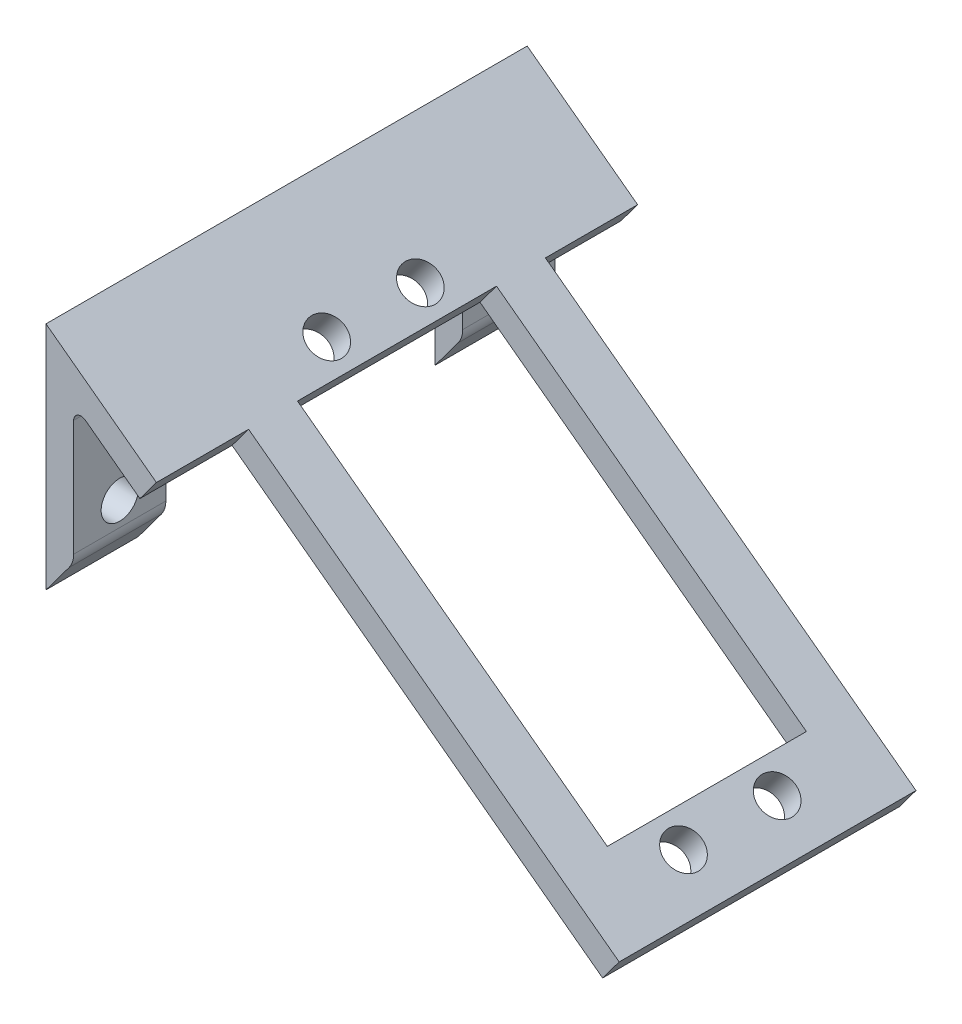
from build123d import *

# Parameters (mm, degrees)
BOSS_EXTRUDE1_DEPTH        = 10
CUT_EXTRUDE1_DEPTH         = 24.288163202
M3_5_CLEARANCE_HOLE1_D     = 4.04
M3_5_CLEARANCE_HOLE1_DEPTH = 11.976330523
M3_5_CLEARANCE_HOLE2_D     = 4.04
M3_5_CLEARANCE_HOLE2_DEPTH = 3
FILLET1_R                  = 2.5
COMBINE1_START             = -42.798318907
COMBINE1_DEPTH             = 32.198103497
COMBINE1_START_2           = -52.798318907
COMBINE1_2_DEPTH           = 10
COMBINE1_3_DEPTH           = 5.304051749
COMBINE1_START_3           = -15.904267158
COMBINE1_4_DEPTH           = 5.304051748


with BuildPart() as part:
    # Sketch1 → Boss-Extrude1 (new body)
    with BuildSketch(Plane.XY.offset(-0.60021541)):
        Polygon((-11.469163068, -7.348185616), (-11.452492295, -7.348185616), (0.507167456, 8.709585816), (-11.469163068, 17.629431184), align=None)
    extrude(amount=-BOSS_EXTRUDE1_DEPTH)

    # Sketch2 → Cut-Extrude1 (cut, through all)
    with BuildSketch(Plane(origin=(0, 0, -10.60021541), x_dir=(-1, 0, 0), z_dir=(0, 0, -1))):
        with BuildLine():
            Line((8.469163068, -3.342585136), (8.469163068, 10.061084473))
            ThreePointArc((8.469163068, 10.061084473), (8.028129493, 10.776027202), (7.191305305, 10.702685563))
            Line((7.191305305, 10.702685563), (1.284799154, 6.303581729))
            Line((1.284799154, 6.303581729), (8.469163068, -3.342585136))
        make_face()
    extrude(amount=-CUT_EXTRUDE1_DEPTH, mode=Mode.SUBTRACT)

    # M3.5 Clearance Hole1
    with Locations(Plane.ZY.offset(11.469163068)):
        with Locations((-5.60021541, 0.106053799)):
            Hole(M3_5_CLEARANCE_HOLE1_D / 2, depth=M3_5_CLEARANCE_HOLE1_DEPTH)

    # M3.5 Clearance Hole2
    with Locations(Plane.ZY.offset(11.469163068)):
        with Locations((-5.60021541, 8.106053799)):
            Hole(M3_5_CLEARANCE_HOLE2_D / 2, depth=M3_5_CLEARANCE_HOLE2_DEPTH)

    # Fillet1
    fillet1_edges = [part.edges().sort_by_distance(p)[0] for p in [
        (-8.469163068, -3.342585136, -5.60021541),
    ]]
    fillet(fillet1_edges, radius=FILLET1_R)

    # Combine1: read off the stored shape, not the designer's step
    # Combine1 outline → Combine1 (add)
    with BuildSketch(Plane.XY.offset(COMBINE1_START)):
        Polygon((-1.284799143, 6.30358172), (0.507167468, 8.709585807), (-11.469163068, 17.629431184), (-11.469163068, 13.888789159), align=None)
        Polygon((40.70546383, -21.229683728), (34.119044566, -16.324187738), (32.327077956, -18.730191825), (38.913497219, -23.635687815), align=None)
    extrude(amount=COMBINE1_DEPTH)

    # Combine1 2 outline → Combine1 2 (add)
    with BuildSketch(Plane.XY.offset(COMBINE1_START_2)):
        with BuildLine():
            Line((-1.284799143, 6.30358172), (0.507167468, 8.709585807))
            Line((0.507167468, 8.709585807), (-11.469163068, 17.629431184))
            Line((-11.469163068, 17.629431184), (-11.469163068, -7.348185616))
            Line((-11.469163068, -7.348185616), (-11.452492295, -7.348185616))
            Line((-11.452492295, -7.348185616), (-8.964159662, -4.00719787))
            ThreePointArc((-8.964159662, -4.00719787), (-8.596136676, -3.300496292), (-8.469163068, -2.513892362))
            Line((-8.469163068, -2.513892362), (-8.469163068, 10.061084473))
            ThreePointArc((-8.469163068, 10.061084473), (-8.028129494, 10.776027202), (-7.191305305, 10.702685563))
            Line((-7.191305305, 10.702685563), (-1.284799143, 6.30358172))
        make_face()
    extrude(amount=COMBINE1_2_DEPTH)

    # Combine1 3 outline → Combine1 3 (add)
    with BuildSketch(Plane.XY.offset(COMBINE1_START)):
        Polygon((34.119044566, -16.324187738), (0.507167462, 8.709585812), (-1.284799143, 6.30358172), (32.327077956, -18.730191825), align=None)
    extrude(amount=COMBINE1_3_DEPTH)

    # Combine1 4 outline → Combine1 4 (add)
    with BuildSketch(Plane.XY.offset(COMBINE1_START_3)):
        Polygon((34.119044566, -16.324187738), (0.507167462, 8.709585812), (-1.284799143, 6.30358172), (32.327077956, -18.730191825), align=None)
    extrude(amount=COMBINE1_4_DEPTH)

    # Combine1 5: loft between two sections, ruled curve by curve
    combine1_5_from = [
        Edge.make_three_point_arc((36.665398892, -18.220685734, -29.759967158), (35.045917541, -17.014513008, -31.779267158), (36.665398892, -18.220685734, -33.798567158)),
        Edge.make_three_point_arc((36.665398892, -18.220685734, -33.798567158), (38.284880243, -19.426858459, -31.779267158), (36.665398892, -18.220685734, -29.759967158)),
    ]
    combine1_5_to = [
        Edge.make_three_point_arc((34.873432281, -20.626689821, -29.759967158), (33.25395093, -19.420517096, -31.779267158), (34.873432281, -20.626689821, -33.798567158)),
        Edge.make_three_point_arc((34.873432281, -20.626689821, -33.798567158), (36.492913632, -21.832862546, -31.779267158), (34.873432281, -20.626689821, -29.759967158)),
    ]
    combine1_5 = Solid(Shell([*[Face.make_surface_from_curves(combine1_5_from[k], combine1_5_to[k]) for k in range(2)], Face(Wire(combine1_5_from)), Face(Wire(combine1_5_to))]))
    add(combine1_5, mode=Mode.SUBTRACT)

    # Combine1 6: loft between two sections, ruled curve by curve
    combine1_6_from = [
        Edge.make_three_point_arc((36.665398892, -18.220685734, -19.599967158), (35.045917541, -17.014513008, -21.619267158), (36.665398892, -18.220685734, -23.638567158)),
        Edge.make_three_point_arc((36.665398892, -18.220685734, -23.638567158), (38.284880243, -19.426858459, -21.619267158), (36.665398892, -18.220685734, -19.599967158)),
    ]
    combine1_6_to = [
        Edge.make_three_point_arc((34.873432281, -20.626689821, -19.599967158), (33.25395093, -19.420517096, -21.619267158), (34.873432281, -20.626689821, -23.638567158)),
        Edge.make_three_point_arc((34.873432281, -20.626689821, -23.638567158), (36.492913632, -21.832862546, -21.619267158), (34.873432281, -20.626689821, -19.599967158)),
    ]
    combine1_6 = Solid(Shell([*[Face.make_surface_from_curves(combine1_6_from[k], combine1_6_to[k]) for k in range(2)], Face(Wire(combine1_6_from)), Face(Wire(combine1_6_to))]))
    add(combine1_6, mode=Mode.SUBTRACT)

    # Combine1 7: loft between two sections, ruled curve by curve
    combine1_7_from = [
        Edge.make_three_point_arc((-2.039186858, 10.606083803, -29.759967158), (-3.658668209, 11.812256529, -31.779267158), (-2.039186858, 10.606083803, -33.798567158)),
        Edge.make_three_point_arc((-2.039186858, 10.606083803, -33.798567158), (-0.419705507, 9.399911078, -31.779267158), (-2.039186858, 10.606083803, -29.759967158)),
    ]
    combine1_7_to = [
        Edge.make_three_point_arc((-3.831153468, 8.200079716, -29.759967158), (-5.45063482, 9.406252441, -31.779267158), (-3.831153468, 8.200079716, -33.798567158)),
        Edge.make_three_point_arc((-3.831153468, 8.200079716, -33.798567158), (-2.211672117, 6.993906991, -31.779267158), (-3.831153468, 8.200079716, -29.759967158)),
    ]
    combine1_7 = Solid(Shell([*[Face.make_surface_from_curves(combine1_7_from[k], combine1_7_to[k]) for k in range(2)], Face(Wire(combine1_7_from)), Face(Wire(combine1_7_to))]))
    add(combine1_7, mode=Mode.SUBTRACT)

    # Combine1 8: loft between two sections, ruled curve by curve
    combine1_8_from = [
        Edge.make_three_point_arc((-2.039186858, 10.606083803, -19.599967158), (-3.658668209, 11.812256529, -21.619267158), (-2.039186858, 10.606083803, -23.638567158)),
        Edge.make_three_point_arc((-2.039186858, 10.606083803, -23.638567158), (-0.419705507, 9.399911078, -21.619267158), (-2.039186858, 10.606083803, -19.599967158)),
    ]
    combine1_8_to = [
        Edge.make_three_point_arc((-3.831153468, 8.200079716, -19.599967158), (-5.45063482, 9.406252441, -21.619267158), (-3.831153468, 8.200079716, -23.638567158)),
        Edge.make_three_point_arc((-3.831153468, 8.200079716, -23.638567158), (-2.211672117, 6.993906991, -21.619267158), (-3.831153468, 8.200079716, -19.599967158)),
    ]
    combine1_8 = Solid(Shell([*[Face.make_surface_from_curves(combine1_8_from[k], combine1_8_to[k]) for k in range(2)], Face(Wire(combine1_8_from)), Face(Wire(combine1_8_to))]))
    add(combine1_8, mode=Mode.SUBTRACT)

    # Combine1 9: loft between two sections, ruled curve by curve
    combine1_9_from = [
        Edge.make_three_point_arc((-8.466516755, 8.106053799, -45.778318907), (-8.466516755, 10.126053799, -47.798318907), (-8.466516755, 8.106053799, -49.818318907)),
        Edge.make_three_point_arc((-8.466516755, 8.106053799, -49.818318907), (-8.466516755, 6.086053799, -47.798318907), (-8.466516755, 8.106053799, -45.778318907)),
    ]
    combine1_9_to = [
        Edge.make_three_point_arc((-11.469163068, 8.106053799, -45.778318907), (-11.469163068, 10.126053799, -47.798318907), (-11.469163068, 8.106053799, -49.818318907)),
        Edge.make_three_point_arc((-11.469163068, 8.106053799, -49.818318907), (-11.469163068, 6.086053799, -47.798318907), (-11.469163068, 8.106053799, -45.778318907)),
    ]
    combine1_9 = Solid(Shell([*[Face.make_surface_from_curves(combine1_9_from[k], combine1_9_to[k]) for k in range(2)], Face(Wire(combine1_9_from)), Face(Wire(combine1_9_to))]))
    add(combine1_9, mode=Mode.SUBTRACT)

    # Combine1 10: loft between two sections, ruled curve by curve
    combine1_10_from = [
        Edge.make_three_point_arc((-8.469163068, 0.106053799, -45.778318907), (-8.469163068, 2.126053799, -47.798318907), (-8.469163068, 0.106053799, -49.818318907)),
        Edge.make_three_point_arc((-8.469163068, 0.106053799, -49.818318907), (-8.469163068, -1.913946201, -47.798318907), (-8.469163068, 0.106053799, -45.778318907)),
    ]
    combine1_10_to = [
        Edge.make_three_point_arc((-11.469163068, 0.106053799, -45.778318907), (-11.469163068, 2.126053799, -47.798318907), (-11.469163068, 0.106053799, -49.818318907)),
        Edge.make_three_point_arc((-11.469163068, 0.106053799, -49.818318907), (-11.469163068, -1.913946201, -47.798318907), (-11.469163068, 0.106053799, -45.778318907)),
    ]
    combine1_10 = Solid(Shell([*[Face.make_surface_from_curves(combine1_10_from[k], combine1_10_to[k]) for k in range(2)], Face(Wire(combine1_10_from)), Face(Wire(combine1_10_to))]))
    add(combine1_10, mode=Mode.SUBTRACT)


solid = part.part
